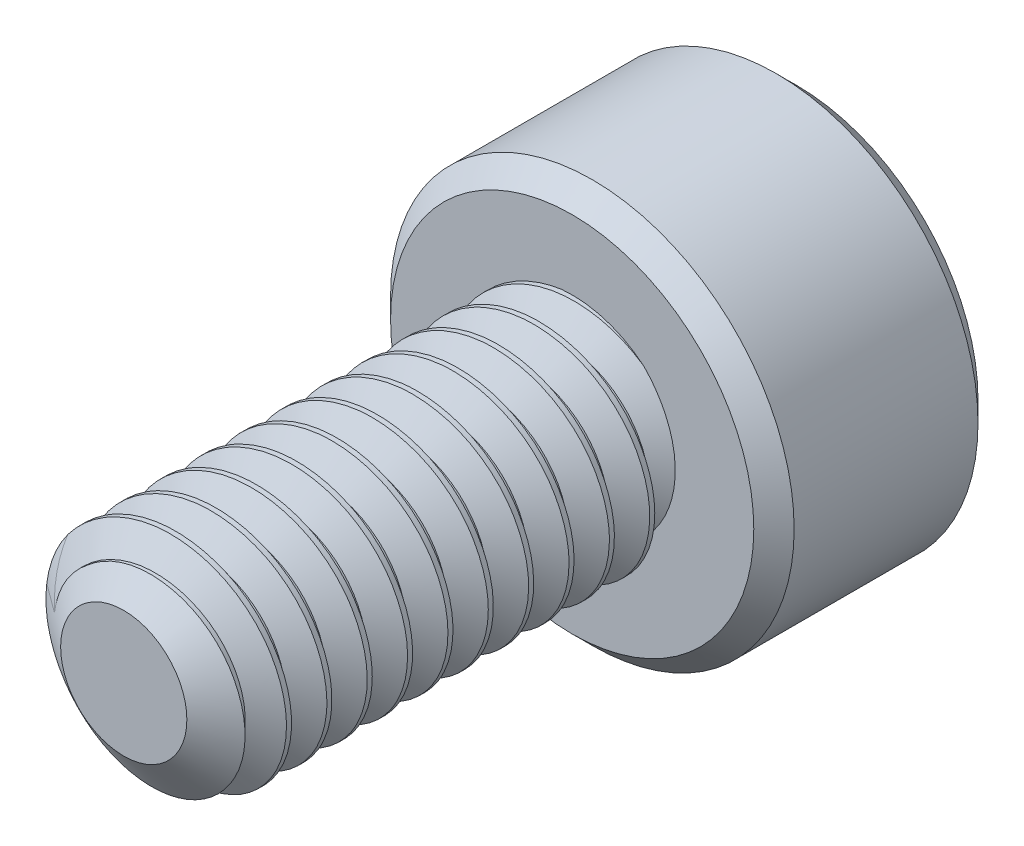
from build123d import *

# Parameters (mm, degrees)
SKETCH1_R          = 1.25
EXTRUDE1_DEPTH     = 5
CUT_SWEEP1_PITCH   = 0.45
SKETCH6_R          = 2.25
EXTRUDE2_DEPTH     = 2.5
CUT_EXTRUDE1_DEPTH = 1.5
CHAMFER1_SIZE      = 0.225


with BuildPart() as part:
    # Sketch1 → Extrude1 (new body)
    with BuildSketch(Plane.XY):
        Circle(SKETCH1_R)
    extrude(amount=-EXTRUDE1_DEPTH)

    # Cut-Sweep1: the profile of Sketch3 profile screwed along a right-hand helix of 12.111111 turns, 6 arcs to a turn; built about Z, then put on its axis
    cut_sweep1_z = Axis((0, 0, 0), (0, 0, 1))
    cut_sweep1_corners = [(1.2503, 0, -0.393923205), (0.957716426, 0, -0.225), (0.957716426, 0, -0.16875), (1.2503, 0, 0.000173205)]
    with BuildLine(mode=Mode.PRIVATE) as cut_sweep1_profile:
        Line(cut_sweep1_corners[0], cut_sweep1_corners[1])
        Line(cut_sweep1_corners[1], cut_sweep1_corners[2])
        Line(cut_sweep1_corners[2], cut_sweep1_corners[3])
        Line(cut_sweep1_corners[3], cut_sweep1_corners[0])
    cut_sweep1_cap = Face(cut_sweep1_profile.wire())
    cut_sweep1_turn_angles = [0, 30, 60, 90, 120, 150, 180, 210, 240, 270, 300, 330, 360]
    cut_sweep1_turn_weights = [1, 0.8660254037844387, 1, 0.8660254037844387, 1, 0.8660254037844387, 1, 0.8660254037844387, 1, 0.8660254037844387, 1, 0.8660254037844387, 1]
    cut_sweep1_turn_rails = [Edge.make_bspline([Vector(p[0], p[1], 0).rotate(cut_sweep1_z, cut_sweep1_turn_angles[k]) / cut_sweep1_turn_weights[k] + Vector(0, 0, p[2] + CUT_SWEEP1_PITCH * cut_sweep1_turn_angles[k] / 360) for k in range(13)], [0, 0, 0, 1, 1, 2, 2, 3, 3, 4, 4, 5, 5, 6, 6, 6], 2, cut_sweep1_turn_weights) for p in cut_sweep1_corners]
    cut_sweep1_turn_sides = [Face.make_surface_from_curves(cut_sweep1_turn_rails[p[0]], cut_sweep1_turn_rails[p[1]]) for p in [(0, 1), (1, 2), (2, 3), (3, 0)]]
    cut_sweep1_last_angles = [4320, 4340, 4360]
    cut_sweep1_last_weights = [1, 0.9396926207859084, 1]
    cut_sweep1_last_rails = [Edge.make_bspline([Vector(p[0], p[1], 0).rotate(cut_sweep1_z, cut_sweep1_last_angles[k]) / cut_sweep1_last_weights[k] + Vector(0, 0, p[2] + CUT_SWEEP1_PITCH * cut_sweep1_last_angles[k] / 360) for k in range(3)], [0, 0, 0, 1, 1, 1], 2, cut_sweep1_last_weights) for p in cut_sweep1_corners]
    cut_sweep1_last_sides = [Face.make_surface_from_curves(cut_sweep1_last_rails[p[0]], cut_sweep1_last_rails[p[1]]) for p in [(0, 1), (1, 2), (2, 3), (3, 0)]]
    cut_sweep1 = Plane(origin=(0, 0, 0), x_dir=(0, 1, 0), z_dir=(0, 0, -1)) * Solid(Shell([*[p.moved(Location((0, 0, CUT_SWEEP1_PITCH * i))) for i in range(12) for p in cut_sweep1_turn_sides], *cut_sweep1_last_sides, cut_sweep1_cap, cut_sweep1_cap.rotate(cut_sweep1_z, 4360).moved(Location((0, 0, CUT_SWEEP1_PITCH * 4360 / 360)))]))
    add(cut_sweep1, mode=Mode.SUBTRACT)

    # Sketch4 → Cut-Revolve1 (revolve, cut)
    with BuildSketch(Plane(origin=(0, 0, 0), x_dir=(0, 0, -1), z_dir=(1, 0, 0)), mode=Mode.PRIVATE) as cut_revolve1_sk:
        Polygon((0.382511876, 1.25), (0, 0.703716426), (0, 1.25), align=None)
    revolve(cut_revolve1_sk.sketch.rotate(Axis((0, 0, 0), (0, 0, -1)), 276.971148597), axis=Axis((0, 0, 0), (0, 0, -1)), mode=Mode.SUBTRACT)

    # Sketch6 → Extrude2 (add)
    with BuildSketch(Plane(origin=(0, 0, -5), x_dir=(-1, 0, 0), z_dir=(0, 0, -1))):
        Circle(SKETCH6_R)
    extrude(amount=EXTRUDE2_DEPTH)

    # Sketch7 → Cut-Extrude1 (cut)
    with BuildSketch(Plane(origin=(0, 0, -7.5), x_dir=(-1, 0, 0), z_dir=(0, 0, -1))):
        Polygon((0, 1.154700538), (-1, 0.577350269), (-1, -0.577350269), (0, -1.154700538), (1, -0.577350269), (1, 0.577350269), align=None)
    extrude(amount=-CUT_EXTRUDE1_DEPTH, mode=Mode.SUBTRACT)

    # Cut-Extrude2 cone 1 section (through the dimple's axis) → Cut-Extrude2 (revolve, cut)
    with BuildSketch(Plane(origin=(0, 0, -7.5), x_dir=(0, 1, 0), z_dir=(1, 0, 0))):
        Polygon((0, 0), (1.154700538, 0), (0, 1.154700538), align=None)
    revolve(axis=Axis((0, 0, -7.5), (0, 0, 1)), mode=Mode.SUBTRACT)

    # Chamfer1
    chamfer1_edges = [part.edges().sort_by_distance(p)[0] for p in [
        (2.25, 0, -5),
        (2.25, 0, -7.5),
    ]]
    chamfer(chamfer1_edges, length=CHAMFER1_SIZE)


solid = part.part
